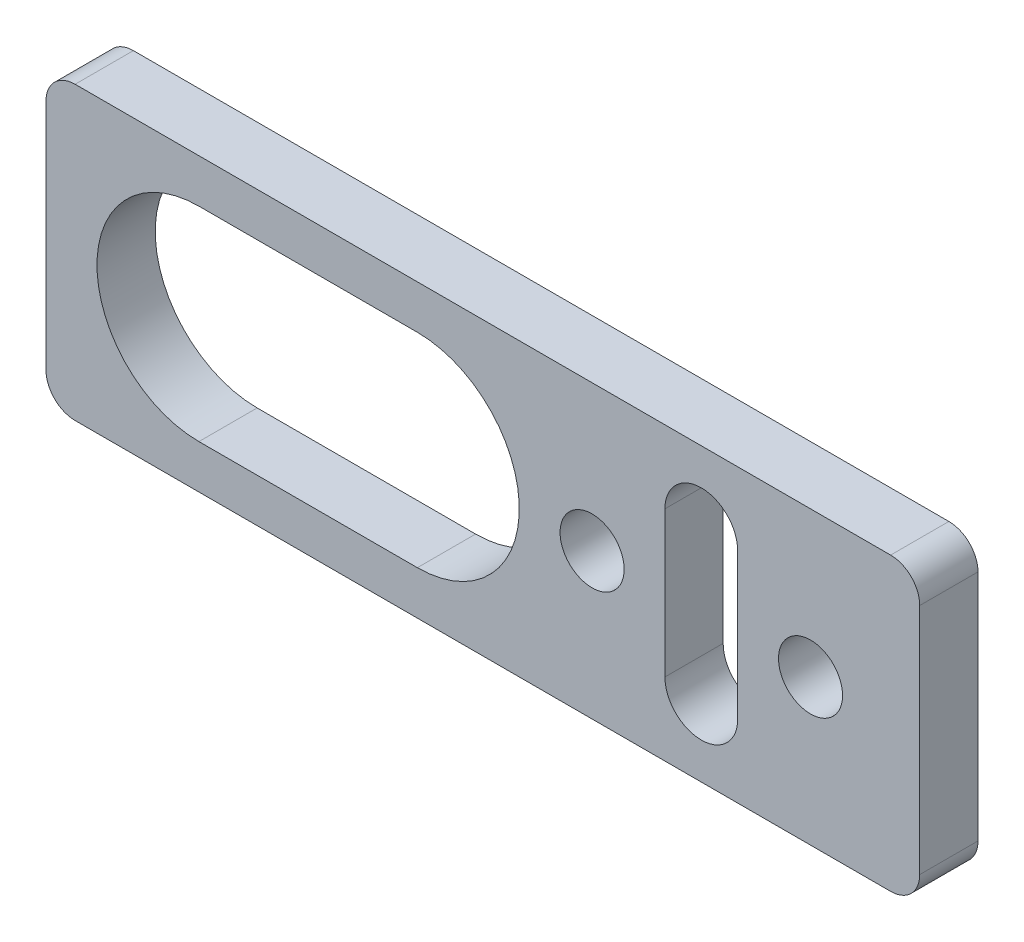
from build123d import *

# Parameters (mm, degrees)
SKETCH_1_W          = 60
SKETCH_1_H          = 20
EXTRUDE_1_DEPTH     = 4
FILLET_1_R          = 2
SKETCH_2_R          = 2.2
CUT_EXTRUDE_1_DEPTH = 32.874754901
CUT_EXTRUDE_2_DEPTH = 32.874754901


with BuildPart() as part:
    # 草图1 → 凸台-拉伸1 (new body)
    with BuildSketch(Plane.XY):
        Rectangle(SKETCH_1_W, SKETCH_1_H)
    extrude(amount=EXTRUDE_1_DEPTH)

    # 圆角1
    fillet_1_edges = [part.edges().sort_by_distance(p)[0] for p in [
        (30, 10, 2),
        (30, -10, 2),
        (-30, -10, 2),
        (-30, 10, 2),
    ]]
    fillet(fillet_1_edges, radius=FILLET_1_R)

    # 草图2 → 切除-拉伸1 (cut, through all)
    with BuildSketch(Plane.XY.offset(4)):
        with Locations((22.5, 0)):
            Circle(SKETCH_2_R)
        with Locations((7.5, 0)):
            Circle(SKETCH_2_R)
    extrude(amount=-CUT_EXTRUDE_1_DEPTH, mode=Mode.SUBTRACT)

    # 草图3 → 切除-拉伸2 (cut, through all)
    with BuildSketch(Plane.XY.offset(4)):
        with BuildLine():
            Line((-19.5, 7), (-4.5, 7))
            ThreePointArc((-4.5, 7), (2.5, 0), (-4.5, -7))
            Line((-4.5, -7), (-19.5, -7))
            ThreePointArc((-19.5, -7), (-26.5, 0), (-19.5, 7))
        make_face()
        with BuildLine():
            Line((12.5, -5), (12.5, 5))
            ThreePointArc((12.5, 5), (15, 7.5), (17.5, 5))
            Line((17.5, 5), (17.5, -5))
            ThreePointArc((17.5, -5), (15, -7.5), (12.5, -5))
        make_face()
    extrude(amount=-CUT_EXTRUDE_2_DEPTH, mode=Mode.SUBTRACT)


solid = part.part
